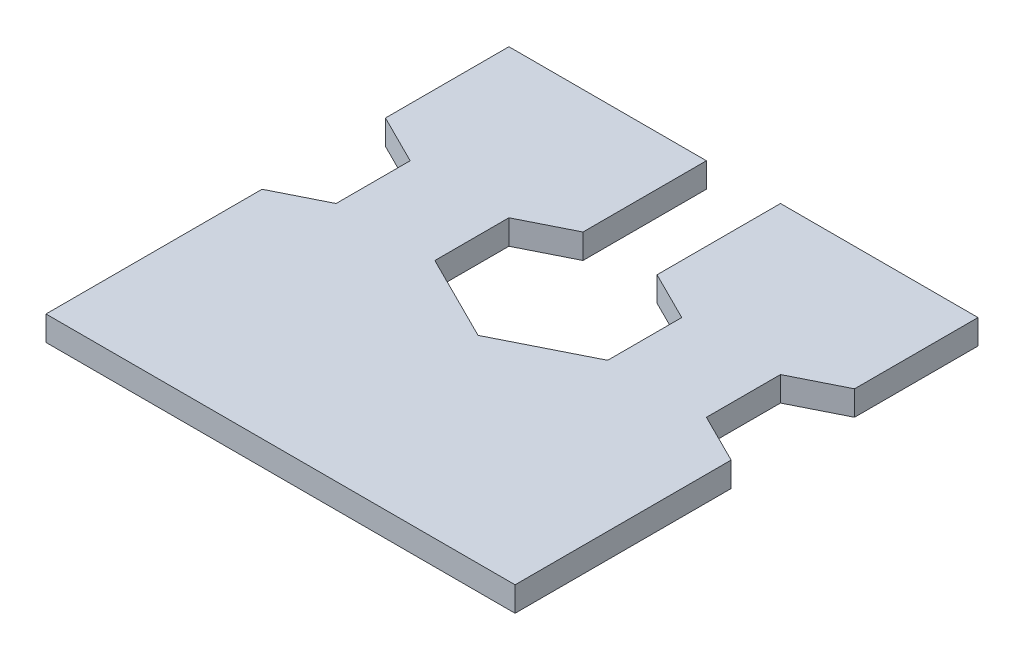
from build123d import *

# Parameters (mm, degrees)
FLANGE_BASE1_DEPTH = 2


# Sheet-metal steps are written as plain solids
with BuildPart() as part:
    # Esboço1 → Flange-base1 (new body)
    with BuildSketch(Plane(origin=(0, 0, 0), x_dir=(1, 0, 0), z_dir=(0, 1, 0))):
        Polygon((3, 37.500755799), (19, 37.500755799), (19, 27.500755799), (15, 25.500755799), (15, 19.500755799), (19, 17.500755799), (19, 0), (-19, 0), (-19, 17.500755799), (-15, 19.500755799), (-15, 25.500755799), (-19, 27.500755799), (-19, 37.500755799), (-3, 37.500755799), (-3, 27.500755799), (-7, 25.500755799), (-7, 19.500755799), (0, 16), (7, 19.500755799), (7, 25.500755799), (3, 27.500755799), align=None)
    extrude(amount=-FLANGE_BASE1_DEPTH)


solid = part.part
